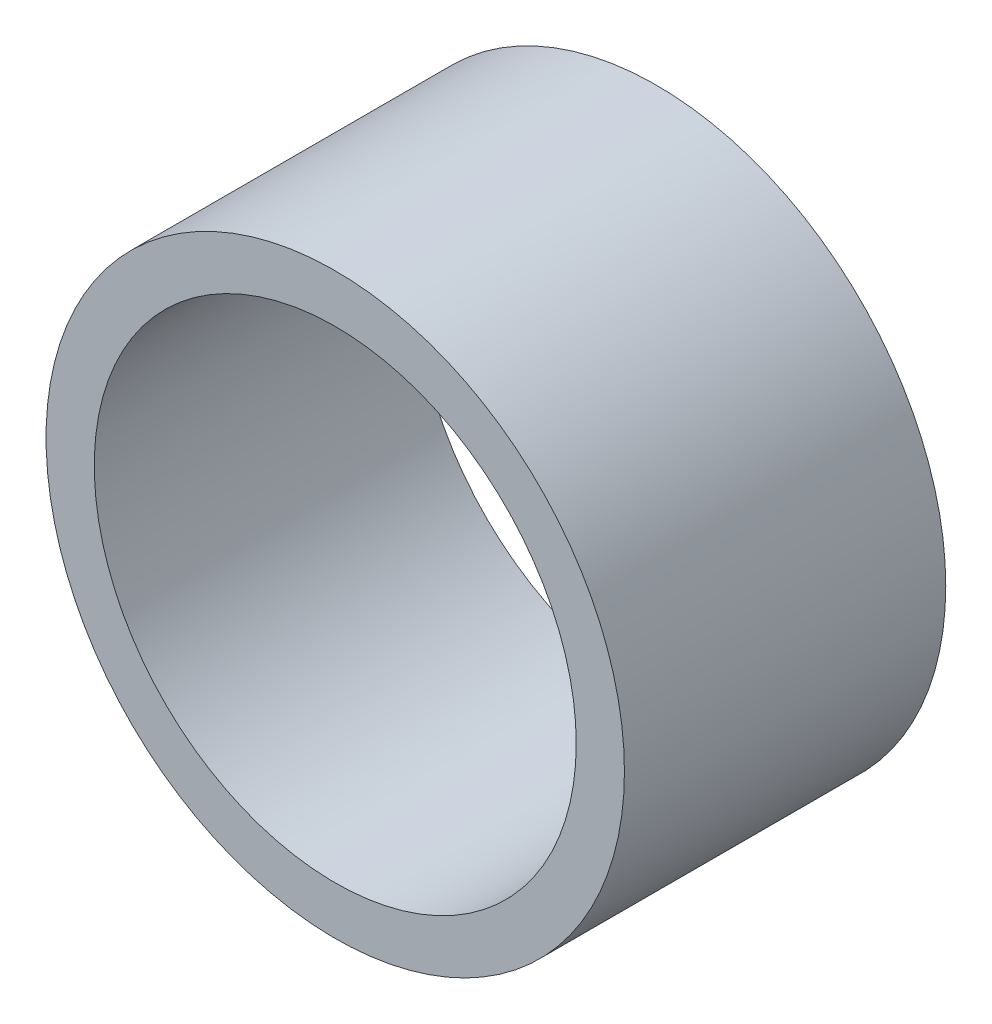
from build123d import *

# Parameters (mm, degrees)
SKETCH1_R           = 9
SKETCH1_R_2         = 7.5
BOSS_EXTRUDE1_DEPTH = 5


with BuildPart() as part:
    # Sketch1 → Boss-Extrude1 (new, symmetric)
    with BuildSketch(Plane.XY):
        Circle(SKETCH1_R)
        Circle(SKETCH1_R_2, mode=Mode.SUBTRACT)
    extrude(amount=BOSS_EXTRUDE1_DEPTH, both=True)


solid = part.part
